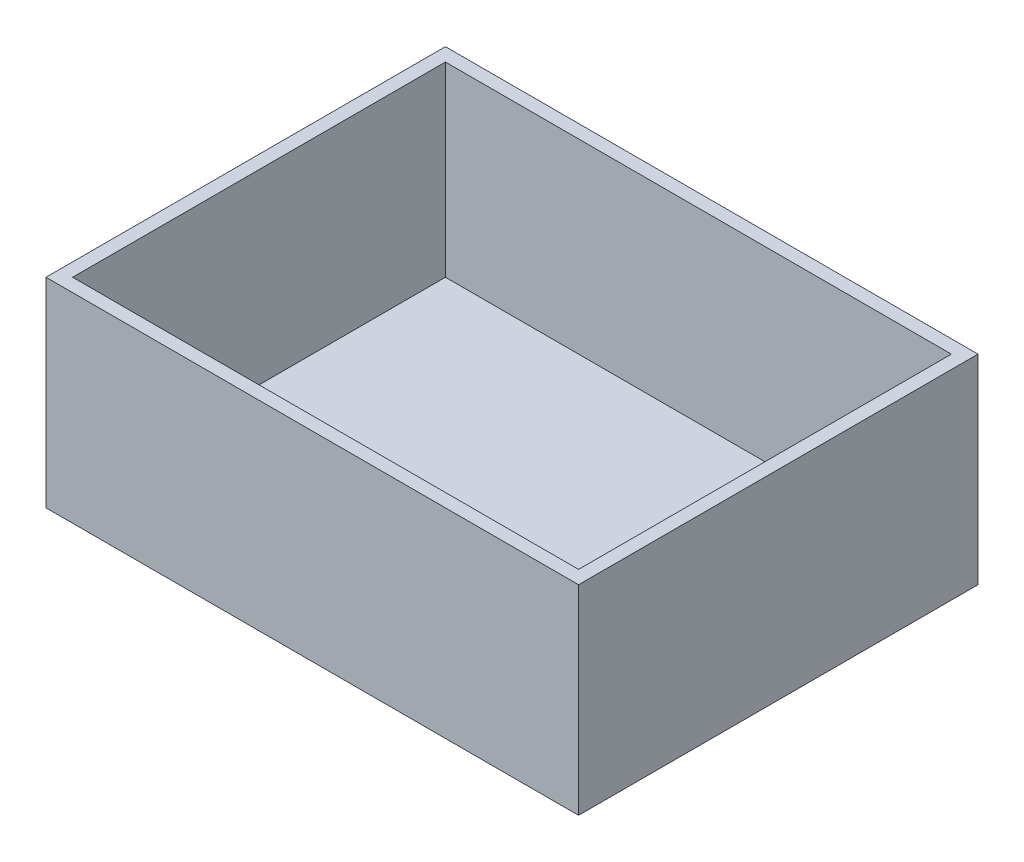
from build123d import *

# Parameters (mm, degrees)
CROQUIS1_W              = 80
CROQUIS1_H              = 60
SALIENTE_EXTRUIR1_DEPTH = 30
VACIADO1_T              = -2


with BuildPart() as part:
    # Croquis1 → Saliente-Extruir1 (new body)
    with BuildSketch(Plane(origin=(0, 0, 0), x_dir=(1, 0, 0), z_dir=(0, 1, 0))):
        Rectangle(CROQUIS1_W, CROQUIS1_H)
    extrude(amount=SALIENTE_EXTRUIR1_DEPTH)

    # Vaciado1
    vaciado1_openings = [part.faces().sort_by_distance(p)[0] for p in [
        (0, 30, 0),
    ]]
    offset(amount=VACIADO1_T, openings=vaciado1_openings, kind=Kind.INTERSECTION)


solid = part.part
